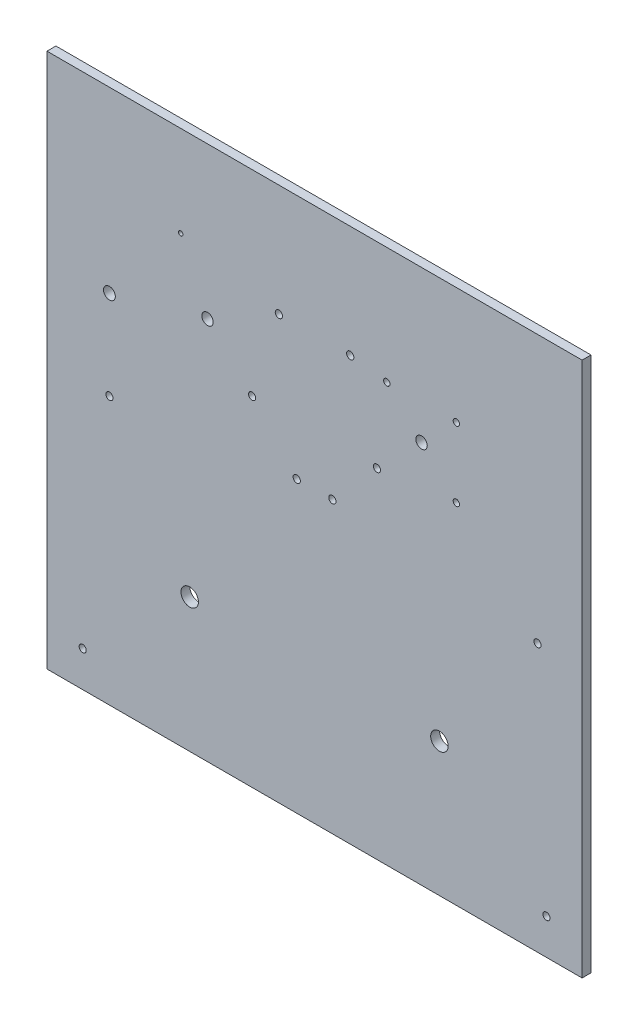
from build123d import *

# Parameters (mm, degrees)
SKETCH1_W               = 381
SKETCH1_H               = 381
SKETCH1_R               = 4.064
SKETCH1_R_2             = 2.54
SKETCH1_R_3             = 6.223
SKETCH1_R_4             = 2.25
SKETCH1_R_5             = 2.5796875
SKETCH1_R_6             = 1.5875
BOSS_EXTRUDE1_DEPTH     = 6.35
F_3_8_24_TAPPED_HOLE2_D = 8.4328


with BuildPart() as part:
    # Sketch1 → Boss-Extrude1 (new body)
    with BuildSketch(Plane.XY):
        with Locations((0, 190.5)):
            Rectangle(SKETCH1_W, SKETCH1_H)
        with Locations((76.2, 273.05)):
            Circle(SKETCH1_R, mode=Mode.SUBTRACT)
        with Locations((44.45, 241.3)):
            Circle(SKETCH1_R_2, mode=Mode.SUBTRACT)
        with Locations((88.9, 95.25)):
            Circle(SKETCH1_R_3, mode=Mode.SUBTRACT)
        with Locations((-165.1, 25.4)):
            Circle(SKETCH1_R_2, mode=Mode.SUBTRACT)
        with Locations((100.948737342, 297.798737342)):
            Circle(SKETCH1_R_4, mode=Mode.SUBTRACT)
        with Locations((158.75, 190.5)):
            Circle(SKETCH1_R_2, mode=Mode.SUBTRACT)
        with Locations((51.451262658, 297.798737342)):
            Circle(SKETCH1_R_4, mode=Mode.SUBTRACT)
        with Locations((165.1, 25.4)):
            Circle(SKETCH1_R_2, mode=Mode.SUBTRACT)
        with Locations((-88.9, 95.25)):
            Circle(SKETCH1_R_3, mode=Mode.SUBTRACT)
        with Locations((12.7, 206.115)):
            Circle(SKETCH1_R_5, mode=Mode.SUBTRACT)
        with Locations((-146.05, 190.5)):
            Circle(SKETCH1_R_2, mode=Mode.SUBTRACT)
        with Locations((-25.4, 301.365)):
            Circle(SKETCH1_R_5, mode=Mode.SUBTRACT)
        with Locations((25.4, 301.365)):
            Circle(SKETCH1_R_5, mode=Mode.SUBTRACT)
        with Locations((-44.45, 241.3)):
            Circle(SKETCH1_R_2, mode=Mode.SUBTRACT)
        with Locations((-76.2, 273.05)):
            Circle(SKETCH1_R, mode=Mode.SUBTRACT)
        with Locations((-12.7, 206.115)):
            Circle(SKETCH1_R_5, mode=Mode.SUBTRACT)
        with Locations((-95.25, 316.23)):
            Circle(SKETCH1_R_6, mode=Mode.SUBTRACT)
        with Locations((100.948737342, 248.301262658)):
            Circle(SKETCH1_R_4, mode=Mode.SUBTRACT)
    extrude(amount=BOSS_EXTRUDE1_DEPTH)

    # 3/8-24 Tapped Hole2 (through all)
    with Locations(Plane.XY.offset(6.35)):
        with Locations((-146.05, 254)):
            Hole(F_3_8_24_TAPPED_HOLE2_D / 2)


solid = part.part
